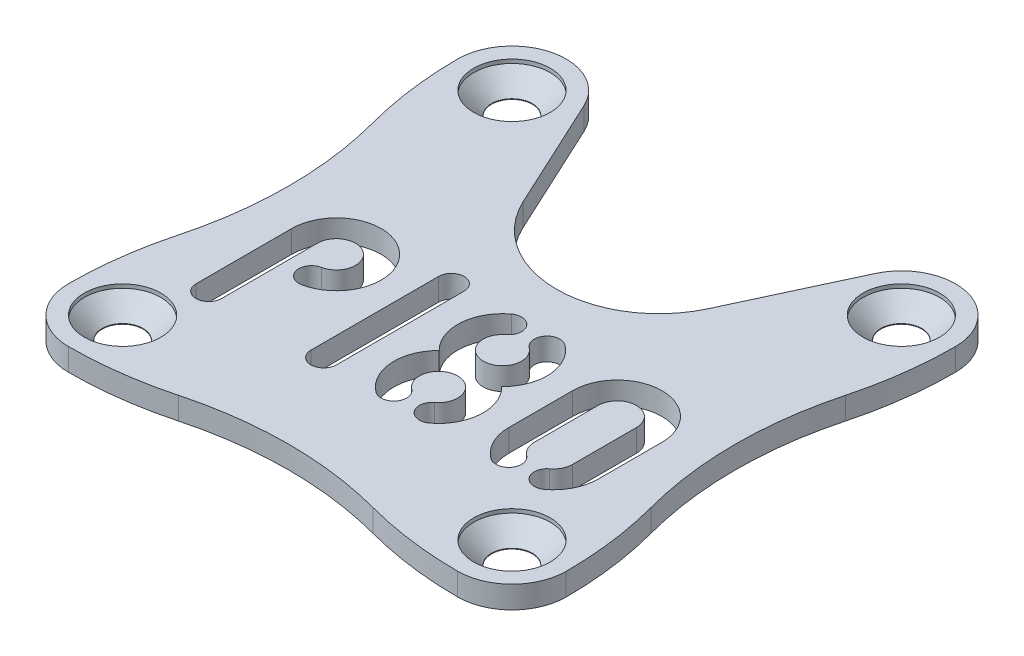
from build123d import *

# Parameters (mm, degrees)
SKETCH1_W                = 39
SKETCH1_H                = 39
SKETCH1_R                = 1.6
SHAPE_DEPTH              = 1.75
CAMERA_CUT_REACH         = 29.633
SKETCH2_R                = 8
SKETCH4_R                = 3
SCREW_HEAD_CUTS_DEPTH    = 0.3
SCREW_HEAD_CHAMFERS_SIZE = 1.4
BEAUTY_CUTS_REACH        = 29.633
NAME_REACH               = 29.633


with BuildPart() as part:
    # Sketch1 → Shape (new body)
    with BuildSketch(Plane(origin=(0, 0, 0), x_dir=(1, 0, 0), z_dir=(0, 1, 0))):
        Rectangle(SKETCH1_W, SKETCH1_H)
        with Locations(Location((-15.25, 15.25, 0), (0, 0, 270))):
            Circle(SKETCH1_R, mode=Mode.SUBTRACT)
        with Locations(Location((15.25, 15.25, 0), (0, 0, 270))):
            Circle(SKETCH1_R, mode=Mode.SUBTRACT)
        with Locations(Location((-15.25, -15.25, 0), (0, 0, 270))):
            Circle(SKETCH1_R, mode=Mode.SUBTRACT)
        with Locations(Location((15.25, -15.25, 0), (0, 0, 270))):
            Circle(SKETCH1_R, mode=Mode.SUBTRACT)
    extrude(amount=SHAPE_DEPTH)

    # Sketch2 → Camera cut (cut, up to next)
    with BuildSketch(Plane(origin=(0, 1.75, 0), x_dir=(1, 0, 0), z_dir=(0, 1, 0)), mode=Mode.PRIVATE) as camera_cut_sk1:
        with BuildLine():
            Line((-11.395707469, 17.040790074), (-7.255139017, 8.12910133))
            ThreePointArc((-7.255139017, 8.12910133), (-6.744152629, 15.803069291), (0, 19.5))
            Line((0, 19.5), (-12.538311002, 19.5))
            Line((-12.538311002, 19.5), (-11.395707469, 17.040790074))
        make_face()
    camera_cut_tool1 = extrude(camera_cut_sk1.sketch, amount=-CAMERA_CUT_REACH, mode=Mode.PRIVATE) & part.part
    # Sketch2 → Camera cut (cut, up to next)
    with BuildSketch(Plane(origin=(0, 1.75, 0), x_dir=(1, 0, 0), z_dir=(0, 1, 0)), mode=Mode.PRIVATE) as camera_cut_sk2:
        with Locations((0, 11.5)):
            Circle(SKETCH2_R)
    camera_cut_tool2 = extrude(camera_cut_sk2.sketch, amount=-CAMERA_CUT_REACH, mode=Mode.PRIVATE) & part.part
    # Sketch2 → Camera cut (cut, up to next)
    with BuildSketch(Plane(origin=(0, 1.75, 0), x_dir=(1, 0, 0), z_dir=(0, 1, 0)), mode=Mode.PRIVATE) as camera_cut_sk3:
        with BuildLine():
            ThreePointArc((8, 11.5), (7.811565533, 9.773893418), (7.255139017, 8.12910133))
            Line((7.255139017, 8.12910133), (11.395707531, 17.040790207))
            Line((11.395707531, 17.040790207), (12.538311002, 19.5))
            Line((12.538311002, 19.5), (0, 19.5))
            ThreePointArc((0, 19.5), (5.656854249, 17.156854249), (8, 11.5))
        make_face()
    camera_cut_tool3 = extrude(camera_cut_sk3.sketch, amount=-CAMERA_CUT_REACH, mode=Mode.PRIVATE) & part.part
    # Sketch2 → Camera cut (cut, up to next)
    with BuildSketch(Plane(origin=(0, 1.75, 0), x_dir=(1, 0, 0), z_dir=(0, 1, 0)), mode=Mode.PRIVATE) as camera_cut_sk4:
        with BuildLine():
            ThreePointArc((-15.249999971, 19.5), (-12.963994499, 18.832831122), (-11.395707469, 17.040790074))
            Line((-11.395707469, 17.040790074), (-12.538311002, 19.5))
            Line((-12.538311002, 19.5), (-15.249999971, 19.5))
        make_face()
    camera_cut_tool4 = extrude(camera_cut_sk4.sketch, amount=-CAMERA_CUT_REACH, mode=Mode.PRIVATE) & part.part
    # Sketch2 → Camera cut (cut, up to next)
    with BuildSketch(Plane(origin=(0, 1.75, 0), x_dir=(1, 0, 0), z_dir=(0, 1, 0)), mode=Mode.PRIVATE) as camera_cut_sk5:
        with BuildLine():
            Line((12.538311002, 19.5), (11.395707531, 17.040790207))
            ThreePointArc((11.395707531, 17.040790207), (12.963994574, 18.83283117), (15.25, 19.5))
            Line((15.25, 19.5), (12.538311002, 19.5))
        make_face()
    camera_cut_tool5 = extrude(camera_cut_sk5.sketch, amount=-CAMERA_CUT_REACH, mode=Mode.PRIVATE) & part.part
    # Sketch2 → Camera cut (cut, up to next)
    with BuildSketch(Plane(origin=(0, 1.75, 0), x_dir=(1, 0, 0), z_dir=(0, 1, 0)), mode=Mode.PRIVATE) as camera_cut_sk6:
        with BuildLine():
            ThreePointArc((-19.5, 15.25), (-18.25520381, 18.25520383), (-15.249999971, 19.5))
            Line((-15.249999971, 19.5), (-19.5, 19.5))
            Line((-19.5, 19.5), (-19.5, 15.25))
        make_face()
    camera_cut_tool6 = extrude(camera_cut_sk6.sketch, amount=-CAMERA_CUT_REACH, mode=Mode.PRIVATE) & part.part
    # Sketch2 → Camera cut (cut, up to next)
    with BuildSketch(Plane(origin=(0, 1.75, 0), x_dir=(1, 0, 0), z_dir=(0, 1, 0)), mode=Mode.PRIVATE) as camera_cut_sk7:
        with BuildLine():
            Line((19.5, 19.5), (15.25, 19.5))
            ThreePointArc((15.25, 19.5), (18.25520382, 18.25520382), (19.5, 15.25))
            Line((19.5, 15.25), (19.5, 19.5))
        make_face()
    camera_cut_tool7 = extrude(camera_cut_sk7.sketch, amount=-CAMERA_CUT_REACH, mode=Mode.PRIVATE) & part.part
    # Sketch2 → Camera cut (cut, up to next)
    with BuildSketch(Plane(origin=(0, 1.75, 0), x_dir=(1, 0, 0), z_dir=(0, 1, 0)), mode=Mode.PRIVATE) as camera_cut_sk8:
        with BuildLine():
            Line((19.5, -19.5), (19.5, -15.25))
            ThreePointArc((19.5, -15.25), (18.255203817, -18.255203823), (15.249999992, -19.5))
            Line((15.249999992, -19.5), (19.5, -19.5))
        make_face()
    camera_cut_tool8 = extrude(camera_cut_sk8.sketch, amount=-CAMERA_CUT_REACH, mode=Mode.PRIVATE) & part.part
    # Sketch2 → Camera cut (cut, up to next)
    with BuildSketch(Plane(origin=(0, 1.75, 0), x_dir=(1, 0, 0), z_dir=(0, 1, 0)), mode=Mode.PRIVATE) as camera_cut_sk9:
        with BuildLine():
            ThreePointArc((-15.25, -19.5), (-18.255203845, -18.255203795), (-19.5, -15.249999928))
            Line((-19.5, -15.249999928), (-19.5, -19.5))
            Line((-19.5, -19.5), (-15.25, -19.5))
        make_face()
    camera_cut_tool9 = extrude(camera_cut_sk9.sketch, amount=-CAMERA_CUT_REACH, mode=Mode.PRIVATE) & part.part
    add(camera_cut_tool1.solids().sort_by_distance((-8.247862, 1.75, -16.762503))[0], mode=Mode.SUBTRACT)
    add(camera_cut_tool2.solids().sort_by_distance((0, 1.75, -11.5))[0], mode=Mode.SUBTRACT)
    add(camera_cut_tool3.solids().sort_by_distance((8.247862, 1.75, -16.762503))[0], mode=Mode.SUBTRACT)
    add(camera_cut_tool4.solids().sort_by_distance((-12.870391, 1.75, -18.979534))[0], mode=Mode.SUBTRACT)
    add(camera_cut_tool5.solids().sort_by_distance((12.870391, 1.75, -18.979534))[0], mode=Mode.SUBTRACT)
    add(camera_cut_tool6.solids().sort_by_distance((-18.550686, 1.75, -18.550686))[0], mode=Mode.SUBTRACT)
    add(camera_cut_tool7.solids().sort_by_distance((18.550686, 1.75, -18.550686))[0], mode=Mode.SUBTRACT)
    add(camera_cut_tool8.solids().sort_by_distance((18.550686, 1.75, 18.550686))[0], mode=Mode.SUBTRACT)
    add(camera_cut_tool9.solids().sort_by_distance((-18.550686, 1.75, 18.550686))[0], mode=Mode.SUBTRACT)

    # Sketch4 → Screw head cuts (cut)
    with BuildSketch(Plane(origin=(0, 1.75, 0), x_dir=(1, 0, 0), z_dir=(0, 1, 0))):
        with Locations(Location((-15.25, 15.25, 0), (0, 0, 270))):
            Circle(SKETCH4_R)
        with Locations(Location((15.25, 15.25, 0), (0, 0, 270))):
            Circle(SKETCH4_R)
        with Locations(Location((15.25, -15.25, 0), (0, 0, 270))):
            Circle(SKETCH4_R)
        with Locations(Location((-15.25, -15.25, 0), (0, 0, 270))):
            Circle(SKETCH4_R)
    extrude(amount=-SCREW_HEAD_CUTS_DEPTH, mode=Mode.SUBTRACT)

    # Screw head chamfers
    screw_head_chamfers_edges = [part.edges().sort_by_distance(p)[0] for p in [
        (15.25, 1.45, 13.65),
        (-15.25, 1.45, 13.65),
        (-15.25, 1.45, -16.85),
        (15.25, 1.45, -16.85),
    ]]
    chamfer(screw_head_chamfers_edges, length=SCREW_HEAD_CHAMFERS_SIZE - 0.0001)  # a hair under: the kernel refuses the full size

    # Sketch5 → Beauty cuts (cut, up to next)
    with BuildSketch(Plane(origin=(0, 1.75, 0), x_dir=(1, 0, 0), z_dir=(0, 1, 0)), mode=Mode.PRIVATE) as beauty_cuts_sk1:
        with BuildLine():
            Line((-19.5, 15.25), (-19.5, -15.25))
            ThreePointArc((-19.5, -15.25), (-19.248934167, -11.404852896), (-18.5, -7.625))
            ThreePointArc((-18.5, -7.625), (-17.5, 0), (-18.5, 7.625))
            ThreePointArc((-18.5, 7.625), (-19.248934167, 11.404852896), (-19.5, 15.25))
        make_face()
    beauty_cuts_tool1 = extrude(beauty_cuts_sk1.sketch, amount=-BEAUTY_CUTS_REACH, mode=Mode.PRIVATE) & part.part
    # Sketch5 → Beauty cuts (cut, up to next)
    with BuildSketch(Plane(origin=(0, 1.75, 0), x_dir=(1, 0, 0), z_dir=(0, 1, 0)), mode=Mode.PRIVATE) as beauty_cuts_sk2:
        with BuildLine():
            Line((-15.25, -19.5), (15.25, -19.5))
            ThreePointArc((15.25, -19.5), (11.404852896, -19.248934167), (7.625, -18.5))
            ThreePointArc((7.625, -18.5), (0, -17.5), (-7.625, -18.5))
            ThreePointArc((-7.625, -18.5), (-11.404852896, -19.248934167), (-15.25, -19.5))
        make_face()
    beauty_cuts_tool2 = extrude(beauty_cuts_sk2.sketch, amount=-BEAUTY_CUTS_REACH, mode=Mode.PRIVATE) & part.part
    # Sketch5 → Beauty cuts (cut, up to next)
    with BuildSketch(Plane(origin=(0, 1.75, 0), x_dir=(1, 0, 0), z_dir=(0, 1, 0)), mode=Mode.PRIVATE) as beauty_cuts_sk3:
        with BuildLine():
            Line((19.5, -15.25), (19.5, 15.25))
            ThreePointArc((19.5, 15.25), (19.248934167, 11.404852896), (18.5, 7.625))
            ThreePointArc((18.5, 7.625), (17.5, 0), (18.5, -7.625))
            ThreePointArc((18.5, -7.625), (19.248934167, -11.404852896), (19.5, -15.25))
        make_face()
    beauty_cuts_tool3 = extrude(beauty_cuts_sk3.sketch, amount=-BEAUTY_CUTS_REACH, mode=Mode.PRIVATE) & part.part
    add(beauty_cuts_tool1.solids().sort_by_distance((-18.732027, 1.75, 0))[0], mode=Mode.SUBTRACT)
    add(beauty_cuts_tool2.solids().sort_by_distance((0, 1.75, 18.732027))[0], mode=Mode.SUBTRACT)
    add(beauty_cuts_tool3.solids().sort_by_distance((18.732027, 1.75, 0))[0], mode=Mode.SUBTRACT)

    # Sketch9 → Name (cut, up to next)
    with BuildSketch(Plane(origin=(0, 1.75, 0), x_dir=(1, 0, 0), z_dir=(0, 1, 0)), mode=Mode.PRIVATE) as name_sk1:
        with BuildLine():
            Line((-14.5, -2.75), (-14.5, -10.25))
            ThreePointArc((-14.5, -10.25), (-13.5, -11.25), (-12.5, -10.25))
            Line((-12.5, -10.25), (-12.5, -2.75))
            ThreePointArc((-12.5, -2.75), (-10.051316701, -1.588104997), (-10.700000002, -4.219693846))
            ThreePointArc((-10.700000002, -4.219693846), (-11.479795894, -5.399489759), (-10.299999969, -6.179285634))
            ThreePointArc((-10.299999969, -6.179285634), (-8.78640565, -0.038911648), (-14.5, -2.75))
        make_face()
    name_tool1 = extrude(name_sk1.sketch, amount=-NAME_REACH, mode=Mode.PRIVATE) & part.part
    # Sketch9 → Name (cut, up to next)
    with BuildSketch(Plane(origin=(0, 1.75, 0), x_dir=(1, 0, 0), z_dir=(0, 1, 0)), mode=Mode.PRIVATE) as name_sk2:
        with BuildLine():
            Line((-3.5, -10.25), (-3.5, -0.25))
            ThreePointArc((-3.5, -0.25), (-4.5, 0.75), (-5.5, -0.25))
            Line((-5.5, -0.25), (-5.5, -10.25))
            ThreePointArc((-5.5, -10.25), (-4.5, -11.25), (-3.5, -10.25))
        make_face()
    name_tool2 = extrude(name_sk2.sketch, amount=-NAME_REACH, mode=Mode.PRIVATE) & part.part
    # Sketch9 → Name (cut, up to next)
    with BuildSketch(Plane(origin=(0, 1.75, 0), x_dir=(1, 0, 0), z_dir=(0, 1, 0)), mode=Mode.PRIVATE) as name_sk3:
        with BuildLine():
            Line((7.5, -2.75), (7.5, -7.75))
            ThreePointArc((7.5, -7.75), (7.869504796, -9.315247513), (8.899999873, -10.549999905))
            ThreePointArc((8.899999873, -10.549999905), (10.299999948, -10.35000007), (10.100000013, -8.950000009))
            ThreePointArc((10.100000013, -8.950000009), (9.658359217, -8.4208204), (9.5, -7.75))
            Line((9.5, -7.75), (9.5, -2.75))
            ThreePointArc((9.5, -2.75), (11, -1.25), (12.5, -2.75))
            Line((12.5, -2.75), (12.5, -7.75))
            ThreePointArc((12.5, -7.75), (12.341640763, -8.420820441), (11.899999915, -8.950000063))
            ThreePointArc((11.899999915, -8.950000063), (11.700000022, -10.350000029), (13.099999973, -10.55000002))
            ThreePointArc((13.099999973, -10.55000002), (14.130495161, -9.315247599), (14.5, -7.75))
            Line((14.5, -7.75), (14.5, -2.75))
            ThreePointArc((14.5, -2.75), (11, 0.75), (7.5, -2.75))
        make_face()
    name_tool3 = extrude(name_sk3.sketch, amount=-NAME_REACH, mode=Mode.PRIVATE) & part.part
    # Sketch9 → Name (cut, up to next)
    with BuildSketch(Plane(origin=(0, 1.75, 0), x_dir=(1, 0, 0), z_dir=(0, 1, 0)), mode=Mode.PRIVATE) as name_sk4:
        with BuildLine():
            ThreePointArc((4.449489743, -5.25), (5.492415246, -2.519705084), (4.100000076, 0.049999943))
            ThreePointArc((4.100000076, 0.049999943), (2.700000014, -0.149999982), (2.90000004, -1.55000003))
            ThreePointArc((2.90000004, -1.55000003), (2.000000004, -4.25), (1.099999954, -1.550000035))
            ThreePointArc((1.099999954, -1.550000035), (1.29999999, -0.149999987), (-0.100000073, 0.049999945))
            ThreePointArc((-0.100000073, 0.049999945), (-1.492415246, -2.519705082), (-0.449489743, -5.25))
            ThreePointArc((-0.449489743, -5.25), (-1.492415245, -7.980294938), (-0.100000041, -10.54999997))
            ThreePointArc((-0.100000041, -10.54999997), (1.300000023, -10.34999997), (1.099999899, -8.949999924))
            ThreePointArc((1.099999899, -8.949999924), (1.999999996, -6.25), (2.900000108, -8.949999919))
            ThreePointArc((2.900000108, -8.949999919), (2.699999963, -10.34999995), (4.100000008, -10.549999994))
            ThreePointArc((4.100000008, -10.549999994), (5.492415243, -7.980294958), (4.449489743, -5.25))
        make_face()
    name_tool4 = extrude(name_sk4.sketch, amount=-NAME_REACH, mode=Mode.PRIVATE) & part.part
    add(name_tool1.solids().sort_by_distance((-8.874269, 1.75, 0.146522))[0], mode=Mode.SUBTRACT)
    add(name_tool2.solids().sort_by_distance((-4.5, 1.75, 5.25))[0], mode=Mode.SUBTRACT)
    add(name_tool3.solids().sort_by_distance((14.365371, 1.75, 5.25))[0], mode=Mode.SUBTRACT)
    add(name_tool4.solids().sort_by_distance((2, 1.75, 5.25))[0], mode=Mode.SUBTRACT)


solid = part.part
